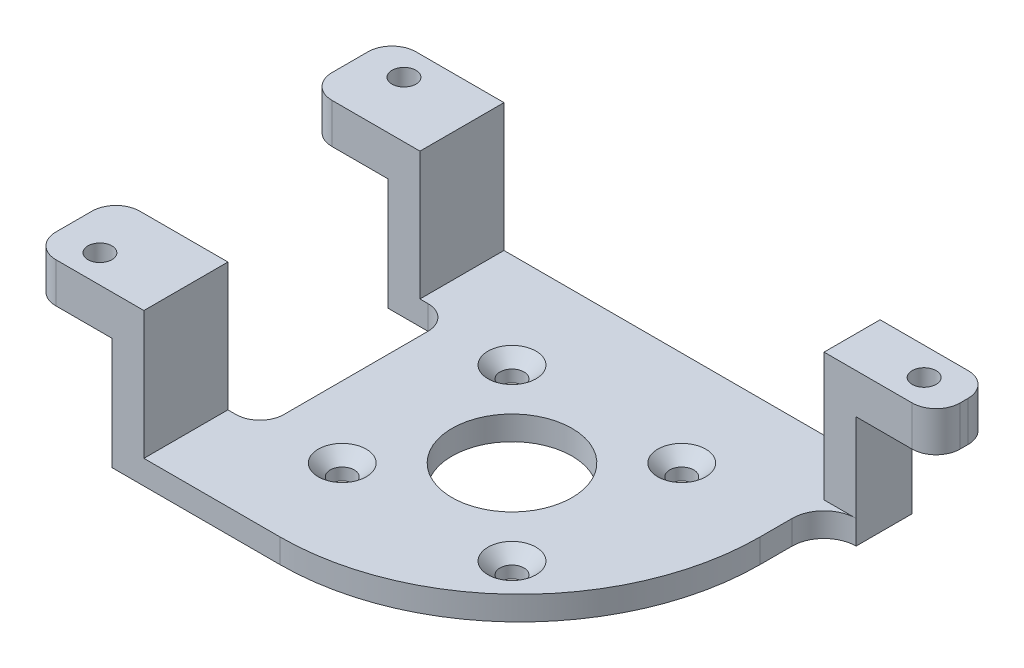
from build123d import *

# Parameters (mm, degrees)
SKETCH_1_W          = 75
SKETCH_1_H          = 45
EXTRUDE_1_DEPTH     = 19
SKETCH_2_W          = 10
SKETCH_2_H          = 45
CUT_EXTRUDE_1_DEPTH = 14
SKETCH_3_W          = 47
SKETCH_3_H          = 45
CUT_EXTRUDE_2_DEPTH = 16
SKETCH_4_R          = 1.5
SKETCH_4_R_2        = 7.5
CUT_EXTRUDE_3_DEPTH = 48.681233206
SKETCH_5_W          = 14
SKETCH_5_H          = 38
CUT_EXTRUDE_4_DEPTH = 48.681233206
FILLET_1_R          = 30
CHAMFER_1_SIZE      = 1.5
SKETCH_8_W          = 36
SKETCH_8_H          = 24
CUT_EXTRUDE_6_DEPTH = 48.681233206
FILLET_2_R          = 3
SKETCH_9_R          = 1.5
CUT_EXTRUDE_7_DEPTH = 46.918405896
FILLET_3_R          = 3
FILLET_4_R          = 4


with BuildPart() as part:
    # 草图1 → 凸台-拉伸1 (new body)
    with BuildSketch(Plane(origin=(0, 0, 0), x_dir=(1, 0, 0), z_dir=(0, 1, 0))):
        Rectangle(SKETCH_1_W, SKETCH_1_H)
    extrude(amount=EXTRUDE_1_DEPTH)

    # 草图2 → 切除-拉伸1 (cut)
    with BuildSketch(Plane.XZ):
        with Locations((-32.5, 0)):
            Rectangle(SKETCH_2_W, SKETCH_2_H)
        with Locations((32.5, 0)):
            Rectangle(SKETCH_2_W, SKETCH_2_H)
    extrude(amount=-CUT_EXTRUDE_1_DEPTH, mode=Mode.SUBTRACT)

    # 草图3 → 切除-拉伸2 (cut)
    with BuildSketch(Plane(origin=(0, 19, 0), x_dir=(1, 0, 0), z_dir=(0, 1, 0))):
        Rectangle(SKETCH_3_W, SKETCH_3_H)
    extrude(amount=-CUT_EXTRUDE_2_DEPTH, mode=Mode.SUBTRACT)

    # 草图4 → 切除-拉伸3 (cut, through all)
    with BuildSketch(Plane.XZ):
        with Locations(Location((10.606601718, 10.606601718, 0), (0, 0, 270))):
            Circle(SKETCH_4_R)
        with Locations(Location((10.606601718, -10.606601718, 0), (0, 0, 270))):
            Circle(SKETCH_4_R)
        with Locations(Location((-10.606601718, -10.606601718, 0), (0, 0, 270))):
            Circle(SKETCH_4_R)
        with Locations(Location((-10.606601718, 10.606601718, 0), (0, 0, 270))):
            Circle(SKETCH_4_R)
        with Locations(Location((0, 0, 0), (0, 0, 270))):
            Circle(SKETCH_4_R_2)
    extrude(amount=-CUT_EXTRUDE_3_DEPTH, mode=Mode.SUBTRACT)

    # 草图5 → 切除-拉伸4 (cut, through all)
    with BuildSketch(Plane(origin=(0, 19, 0), x_dir=(1, 0, 0), z_dir=(0, 1, 0))):
        with Locations((30.5, -3.5)):
            Rectangle(SKETCH_5_W, SKETCH_5_H)
    extrude(amount=-CUT_EXTRUDE_4_DEPTH, mode=Mode.SUBTRACT)

    # 圆角1
    fillet_1_edges = [part.edges().sort_by_distance(p)[0] for p in [
        (23.5, 1.5, 22.5),
    ]]
    fillet(fillet_1_edges, radius=FILLET_1_R)

    # 倒角1
    chamfer_1_edges = [part.edges().sort_by_distance(p)[0] for p in [
        (-10.606601718, 3, 12.106601718),
        (-10.606601718, 3, -9.106601718),
        (10.606601718, 3, -9.106601718),
        (10.606601718, 3, 12.106601718),
    ]]
    chamfer(chamfer_1_edges, length=CHAMFER_1_SIZE)

    # 草图8 → 切除-拉伸6 (cut, through all)
    with BuildSketch(Plane.XZ):
        with Locations((-37.5, 0)):
            Rectangle(SKETCH_8_W, SKETCH_8_H)
    extrude(amount=-CUT_EXTRUDE_6_DEPTH, mode=Mode.SUBTRACT)

    # 圆角2
    fillet_2_edges = [part.edges().sort_by_distance(p)[0] for p in [
        (-19.5, 1.5, 12),
        (-19.5, 1.5, -12),
    ]]
    fillet(fillet_2_edges, radius=FILLET_2_R)

    # 草图9 → 切除-拉伸7 (cut, through all)
    with BuildSketch(Plane.XZ.offset(-14)):
        with Locations(Location((32.5, -19, 0), (0, 0, 270))):
            Circle(SKETCH_9_R)
        with Locations(Location((-32.5, -19, 0), (0, 0, 270))):
            Circle(SKETCH_9_R)
        with Locations(Location((-32.5, 19, 0), (0, 0, 270))):
            Circle(SKETCH_9_R)
    extrude(amount=-CUT_EXTRUDE_7_DEPTH, mode=Mode.SUBTRACT)

    # 圆角3
    fillet_3_edges = [part.edges().sort_by_distance(p)[0] for p in [
        (-37.5, 16.5, 12),
        (-37.5, 16.5, -12),
        (-37.5, 16.5, 22.5),
        (-37.5, 16.5, -22.5),
        (37.5, 16.5, -22.5),
        (37.5, 16.5, -15.5),
    ]]
    fillet(fillet_3_edges, radius=FILLET_3_R)

    # 圆角4
    fillet_4_edges = [part.edges().sort_by_distance(p)[0] for p in [
        (23.5, 1.5, -15.5),
    ]]
    fillet(fillet_4_edges, radius=FILLET_4_R - 0.0001)  # a hair under: the kernel refuses the full size


solid = part.part
